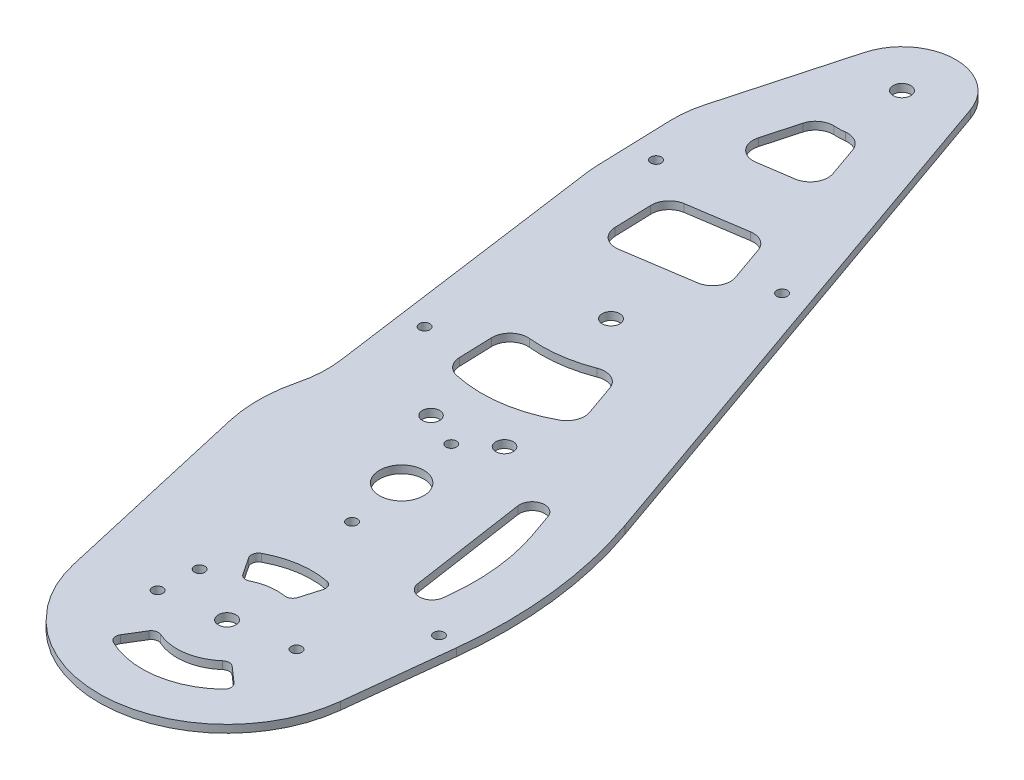
from build123d import *

# Parameters (mm, degrees)
SKETCH1_R           = 1.475
SKETCH1_R_2         = 2.455
SKETCH1_R_3         = 6.168108907
SKETCH1_R_4         = 2.425
BOSS_EXTRUDE1_DEPTH = 2.15


with BuildPart() as part:
    # Sketch1 → Boss-Extrude1 (new body)
    with BuildSketch(Plane(origin=(0, 0, 0), x_dir=(1, 0, 0), z_dir=(0, 1, 0))):
        with BuildLine():
            Line((-52.840792328, -53.480936505), (-39.943608053, -109.938847508))
            ThreePointArc((-39.943608053, -109.938847508), (-37.457286515, -117.158015126), (-33.49327647, -123.683718173))
            add(Edge.make_bspline(
                [(-33.49327647, -123.683718173), (-32.332703554, -125.083194688), (-31.130656762, -126.449768735), (-29.823601535, -127.783624049)],
                knots=[0.313138539, 0.313138539, 0.313138539, 0.313138539, 0.333887075, 0.333887075, 0.333887075, 0.333887075], degree=3))
            ThreePointArc((-29.823601535, -127.783624049), (7.100721182, -135.542158296), (30.379831892, -105.849003085))
            Line((30.379831892, -105.849003085), (33.615544776, -76.788996458))
            ThreePointArc((33.615544776, -76.788996458), (33.579883022, -49.913647939), (27.563931512, -23.720252642))
            Line((27.563931512, -23.720252642), (-24.684189405, 124.939833717))
            ThreePointArc((-24.684189405, 124.939833717), (-39.358339148, 134.957060264), (-53.29909759, 123.942036322))
            Line((-53.29909759, 123.942036322), (-62.855086574, 89.179051807))
            ThreePointArc((-62.855086574, 89.179051807), (-63.719958197, 84.755177464), (-63.912240207, 80.251657202))
            Line((-63.912240207, 80.251657202), (-63.229975042, 59.284277029))
            ThreePointArc((-63.229975042, 59.284277029), (-63.13826073, 57.721544859), (-62.965154571, 56.165724302))
            Line((-62.965154571, 56.165724302), (-52.006314121, -23.382858795))
            ThreePointArc((-52.006314121, -23.382858795), (-51.770839114, -29.123543867), (-52.634069461, -34.803838485))
            ThreePointArc((-52.634069461, -34.803838485), (-53.842880044, -44.130152103), (-52.840792328, -53.480936505))
        make_face()
        with Locations((-21.173132912, -93.573319355)):
            Circle(SKETCH1_R, mode=Mode.SUBTRACT)
        with Locations((-21.93278743, -104.537739321)):
            Circle(SKETCH1_R, mode=Mode.SUBTRACT)
        with Locations((-5.125534576, -101.985044369)):
            Circle(SKETCH1_R_2, mode=Mode.SUBTRACT)
        with Locations((11.681718278, -99.432349418)):
            Circle(SKETCH1_R, mode=Mode.SUBTRACT)
        with Locations((28.194366713, -76.18652158)):
            Circle(SKETCH1_R, mode=Mode.SUBTRACT)
        with Locations((-11.367714255, -60.885777039)):
            Circle(SKETCH1_R, mode=Mode.SUBTRACT)
        with Locations((-13.845329944, -44.572855151)):
            Circle(SKETCH1_R_3, mode=Mode.SUBTRACT)
        with Locations((-8.250860135, -21.470865896)):
            Circle(SKETCH1_R_4, mode=Mode.SUBTRACT)
        with Locations((-16.322945632, -28.259933264)):
            Circle(SKETCH1_R, mode=Mode.SUBTRACT)
        with Locations((-26.046774921, -24.173719374)):
            Circle(SKETCH1_R_4, mode=Mode.SUBTRACT)
        with Locations((-56.366174752, 68.898827029)):
            Circle(SKETCH1_R, mode=Mode.SUBTRACT)
        with Locations((-6.607589019, 54.284808215)):
            Circle(SKETCH1_R, mode=Mode.SUBTRACT)
        with Locations((-24.303871319, 24.287448452)):
            Circle(SKETCH1_R_2, mode=Mode.SUBTRACT)
        with Locations((-48.382600793, -3.644876674)):
            Circle(SKETCH1_R, mode=Mode.SUBTRACT)
        with Locations((-38.835609181, 119.966171251)):
            Circle(SKETCH1_R_2, mode=Mode.SUBTRACT)
        with BuildLine():
            Line((-41.91710805, 82.298512317), (-32.399713849, 83.698520129))
            ThreePointArc((-32.399713849, 83.698520129), (-28.847563923, 86.060107453), (-28.410242809, 90.303174036))
            Line((-28.410242809, 90.303174036), (-31.382797644, 98.76089942))
            ThreePointArc((-31.382797644, 98.76089942), (-33.457293561, 101.347588782), (-36.693970949, 102.067598958))
            ThreePointArc((-36.693970949, 102.067598958), (-38.207418623, 101.950875498), (-39.725320718, 101.961896263))
            ThreePointArc((-39.725320718, 101.961896263), (-42.903984368, 101.018184144), (-44.793265793, 98.293278483))
            Line((-44.793265793, 98.293278483), (-47.465939738, 88.570567092))
            ThreePointArc((-47.465939738, 88.570567092), (-46.389618839, 83.932250043), (-41.91710805, 82.298512317))
        make_face(mode=Mode.SUBTRACT)
        with BuildLine():
            Line((-16.937854779, 51.629343597), (-20.390607974, 61.453363659))
            ThreePointArc((-20.390607974, 61.453363659), (-22.532582385, 64.081327612), (-25.858540532, 64.738785834))
            Line((-25.858540532, 64.738785834), (-41.906447635, 62.301420739))
            ThreePointArc((-41.906447635, 62.301420739), (-44.999859253, 60.55531199), (-46.153010078, 57.195500332))
            Line((-46.153010078, 57.195500332), (-45.817934871, 46.897965596))
            ThreePointArc((-45.817934871, 46.897965596), (-44.01778071, 43.216372089), (-40.069787164, 42.117266677))
            Line((-40.069787164, 42.117266677), (-20.904202072, 45.028146446))
            ThreePointArc((-20.904202072, 45.028146446), (-17.369143264, 47.396290594), (-16.937854779, 51.629343597))
        make_face(mode=Mode.SUBTRACT)
        with BuildLine():
            Line((-4.684973442, -1.328746966), (-7.754910594, 7.406057543))
            ThreePointArc((-7.754910594, 7.406057543), (-10.380057687, 10.289487703), (-14.277602246, 10.410785518))
            ThreePointArc((-14.277602246, 10.410785518), (-22.451748997, 8.304334218), (-30.891622317, 8.154833286))
            ThreePointArc((-30.891622317, 8.154833286), (-34.803601388, 6.83156599), (-36.385841207, 3.016971156))
            Line((-36.385841207, 3.016971156), (-36.0857593, -6.205149132))
            ThreePointArc((-36.0857593, -6.205149132), (-34.939447101, -9.23149884), (-32.179883099, -10.921951659))
            ThreePointArc((-32.179883099, -10.921951659), (-19.269492954, -11.43913062), (-7.004755403, -7.374421459))
            ThreePointArc((-7.004755403, -7.374421459), (-4.733969724, -4.777844919), (-4.684973442, -1.328746966))
        make_face(mode=Mode.SUBTRACT)
        with BuildLine():
            Line((19.844449525, -64.919654726), (19.667617674, -66.50778536))
            ThreePointArc((19.667617674, -66.50778536), (16.251850056, -69.619905943), (12.726728897, -66.632217245))
            Line((12.726728897, -66.632217245), (7.887886505, -33.893633842))
            ThreePointArc((7.887886505, -33.893633842), (10.510299936, -29.984172811), (14.652269896, -32.221363596))
            Line((14.652269896, -32.221363596), (16.818642893, -38.385282818))
            ThreePointArc((16.818642893, -38.385282818), (19.826618648, -51.481980466), (19.844449525, -64.919654726))
        make_face(mode=Mode.SUBTRACT)
        with BuildLine():
            Line((-0.653102394, -86.753585136), (0.966375004, -81.238240696))
            ThreePointArc((0.966375004, -81.238240696), (0.756700894, -79.636373516), (-0.56827267, -78.712043082))
            ThreePointArc((-0.56827267, -78.712043082), (-8.686544033, -78.538926638), (-16.387320245, -81.114648864))
            ThreePointArc((-16.387320245, -81.114648864), (-17.378099073, -82.390697064), (-17.102704245, -83.982582545))
            Line((-17.102704245, -83.982582545), (-13.91868529, -88.768369276))
            ThreePointArc((-13.91868529, -88.768369276), (-12.769636594, -89.592800652), (-11.362539974, -89.451099911))
            ThreePointArc((-11.362539974, -89.451099911), (-7.227753948, -88.143777313), (-2.891266968, -88.164478235))
            ThreePointArc((-2.891266968, -88.164478235), (-1.505550947, -87.882005033), (-0.653102394, -86.753585136))
        make_face(mode=Mode.SUBTRACT)
        with BuildLine():
            Line((6.78872402, -112.475537308), (11.102902912, -116.274167565))
            ThreePointArc((11.102902912, -116.274167565), (11.780924168, -117.740533437), (11.154170887, -119.22953378))
            ThreePointArc((11.154170887, -119.22953378), (-1.564525119, -125.4311621), (-15.551007519, -123.285531193))
            ThreePointArc((-15.551007519, -123.285531193), (-16.591599383, -122.049768162), (-16.379535287, -120.44821563))
            Line((-16.379535287, -120.44821563), (-13.387764062, -115.539953588))
            ThreePointArc((-13.387764062, -115.539953588), (-12.272305428, -114.670613587), (-10.860697091, -114.756415123))
            ThreePointArc((-10.860697091, -114.756415123), (-3.023315204, -115.826311425), (4.142973552, -112.477649245))
            ThreePointArc((4.142973552, -112.477649245), (5.465449668, -111.976593436), (6.78872402, -112.475537308))
        make_face(mode=Mode.SUBTRACT)
    extrude(amount=BOSS_EXTRUDE1_DEPTH)


solid = part.part
